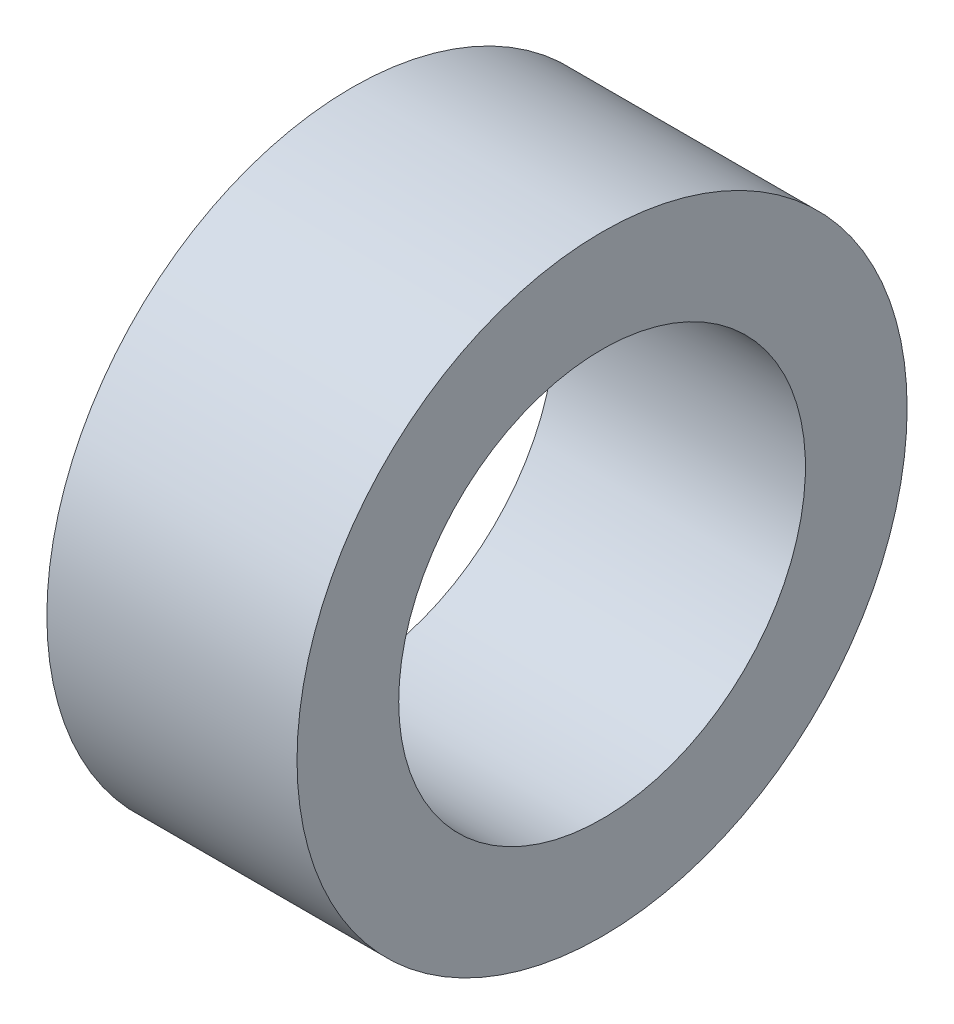
from build123d import *

# Parameters (mm, degrees)
SKETCH1_R           = 9.525
SKETCH1_R_2         = 6.35
BOSS_EXTRUDE1_DEPTH = 7.8105


with BuildPart() as part:
    # Sketch1 → Boss-Extrude1 (new body)
    with BuildSketch(Plane(origin=(0, 0, 0), x_dir=(0, 0, -1), z_dir=(1, 0, 0))):
        Circle(SKETCH1_R)
        Circle(SKETCH1_R_2, mode=Mode.SUBTRACT)
    extrude(amount=BOSS_EXTRUDE1_DEPTH)


solid = part.part
